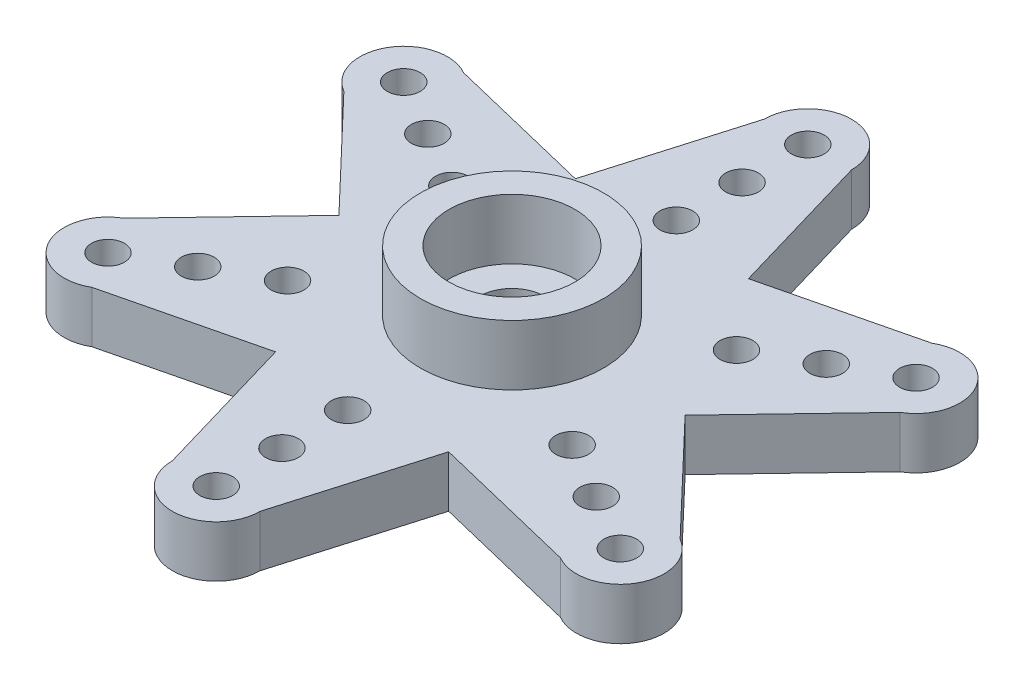
from build123d import *

# Parameters (mm, degrees)
SKETCH1_R           = 0.75
BOSS_EXTRUDE1_DEPTH = 2.35
SKETCH2_R           = 1.5
CUT_EXTRUDE1_DEPTH  = 2.35
SKETCH3_R           = 4.18
SKETCH3_R_2         = 2.875
BOSS_EXTRUDE2_DEPTH = 2.75


with BuildPart() as part:
    # Sketch1 → Boss-Extrude1 (new body)
    with BuildSketch(Plane(origin=(0, 0, 0), x_dir=(1, 0, 0), z_dir=(0, 1, 0))):
        with BuildLine():
            Line((10.691342951, 8.482050808), (3.95, 6.84160069))
            Line((3.95, 6.84160069), (2, 13.5))
            ThreePointArc((2, 13.5), (1.414213562, 14.914213562), (0, 15.5))
            ThreePointArc((0, 15.5), (-1.414213562, 14.914213562), (-2, 13.5))
            Line((-2, 13.5), (-3.95, 6.84160069))
            Line((-3.95, 6.84160069), (-10.691342951, 8.482050808))
            ThreePointArc((-10.691342951, 8.482050808), (-12.208981823, 8.681851443), (-13.423394568, 7.749998599))
            ThreePointArc((-13.423394568, 7.749998599), (-13.623194394, 6.232361128), (-12.691342951, 5.017949192))
            Line((-12.691342951, 5.017949192), (-7.9, 0))
            Line((-7.9, 0), (-12.691342951, -5.017949192))
            ThreePointArc((-12.691342951, -5.017949192), (-13.623194399, -6.232361145), (-13.42339455, -7.749998629))
            ThreePointArc((-13.42339455, -7.749998629), (-12.208981806, -8.681851448), (-10.691342951, -8.482050808))
            Line((-10.691342951, -8.482050808), (-3.95, -6.84160069))
            Line((-3.95, -6.84160069), (-2, -13.5))
            ThreePointArc((-2, -13.5), (-1.414213562, -14.914213562), (0, -15.5))
            ThreePointArc((0, -15.5), (1.414213562, -14.914213562), (2, -13.5))
            Line((2, -13.5), (3.95, -6.84160069))
            Line((3.95, -6.84160069), (10.691342951, -8.482050808))
            ThreePointArc((10.691342951, -8.482050808), (12.208981785, -8.681851453), (13.423394528, -7.749998667))
            ThreePointArc((13.423394528, -7.749998667), (13.623194404, -6.232361166), (12.691342951, -5.017949192))
            Line((12.691342951, -5.017949192), (7.9, 0))
            Line((7.9, 0), (12.691342951, 5.017949192))
            ThreePointArc((12.691342951, 5.017949192), (13.6231944, 6.232361148), (13.423394547, 7.749998635))
            ThreePointArc((13.423394547, 7.749998635), (12.208981803, 8.681851449), (10.691342951, 8.482050808))
        make_face()
        with Locations((-11.691342951, -6.75)):
            Circle(SKETCH1_R, mode=Mode.SUBTRACT)
        with Locations((-9.09326674, -5.25)):
            Circle(SKETCH1_R, mode=Mode.SUBTRACT)
        with Locations((-6.495190528, -3.75)):
            Circle(SKETCH1_R, mode=Mode.SUBTRACT)
        with Locations((0, -13.5)):
            Circle(SKETCH1_R, mode=Mode.SUBTRACT)
        with Locations((0, -10.5)):
            Circle(SKETCH1_R, mode=Mode.SUBTRACT)
        with Locations((0, -7.5)):
            Circle(SKETCH1_R, mode=Mode.SUBTRACT)
        with Locations((6.495190528, -3.75)):
            Circle(SKETCH1_R, mode=Mode.SUBTRACT)
        with Locations((9.09326674, -5.25)):
            Circle(SKETCH1_R, mode=Mode.SUBTRACT)
        with Locations((11.691342951, -6.75)):
            Circle(SKETCH1_R, mode=Mode.SUBTRACT)
        with Locations((-11.691342951, 6.75)):
            Circle(SKETCH1_R, mode=Mode.SUBTRACT)
        with Locations((-9.09326674, 5.25)):
            Circle(SKETCH1_R, mode=Mode.SUBTRACT)
        with Locations((-6.495190528, 3.75)):
            Circle(SKETCH1_R, mode=Mode.SUBTRACT)
        with Locations((0, 7.5)):
            Circle(SKETCH1_R, mode=Mode.SUBTRACT)
        with Locations((0, 10.5)):
            Circle(SKETCH1_R, mode=Mode.SUBTRACT)
        with Locations((6.495190528, 3.75)):
            Circle(SKETCH1_R, mode=Mode.SUBTRACT)
        with Locations((9.09326674, 5.25)):
            Circle(SKETCH1_R, mode=Mode.SUBTRACT)
        with Locations((11.691342951, 6.75)):
            Circle(SKETCH1_R, mode=Mode.SUBTRACT)
        with Locations((0, 13.5)):
            Circle(SKETCH1_R, mode=Mode.SUBTRACT)
    extrude(amount=BOSS_EXTRUDE1_DEPTH)

    # Sketch2 → Cut-Extrude1 (cut)
    with BuildSketch(Plane(origin=(0, 2.35, 0), x_dir=(1, 0, 0), z_dir=(0, 1, 0))):
        Circle(SKETCH2_R)
    extrude(amount=-CUT_EXTRUDE1_DEPTH, mode=Mode.SUBTRACT)

    # Sketch3 → Boss-Extrude2 (add)
    with BuildSketch(Plane(origin=(0, 2.35, 0), x_dir=(1, 0, 0), z_dir=(0, 1, 0))):
        Circle(SKETCH3_R)
        Circle(SKETCH3_R_2, mode=Mode.SUBTRACT)
    extrude(amount=BOSS_EXTRUDE2_DEPTH)


solid = part.part
